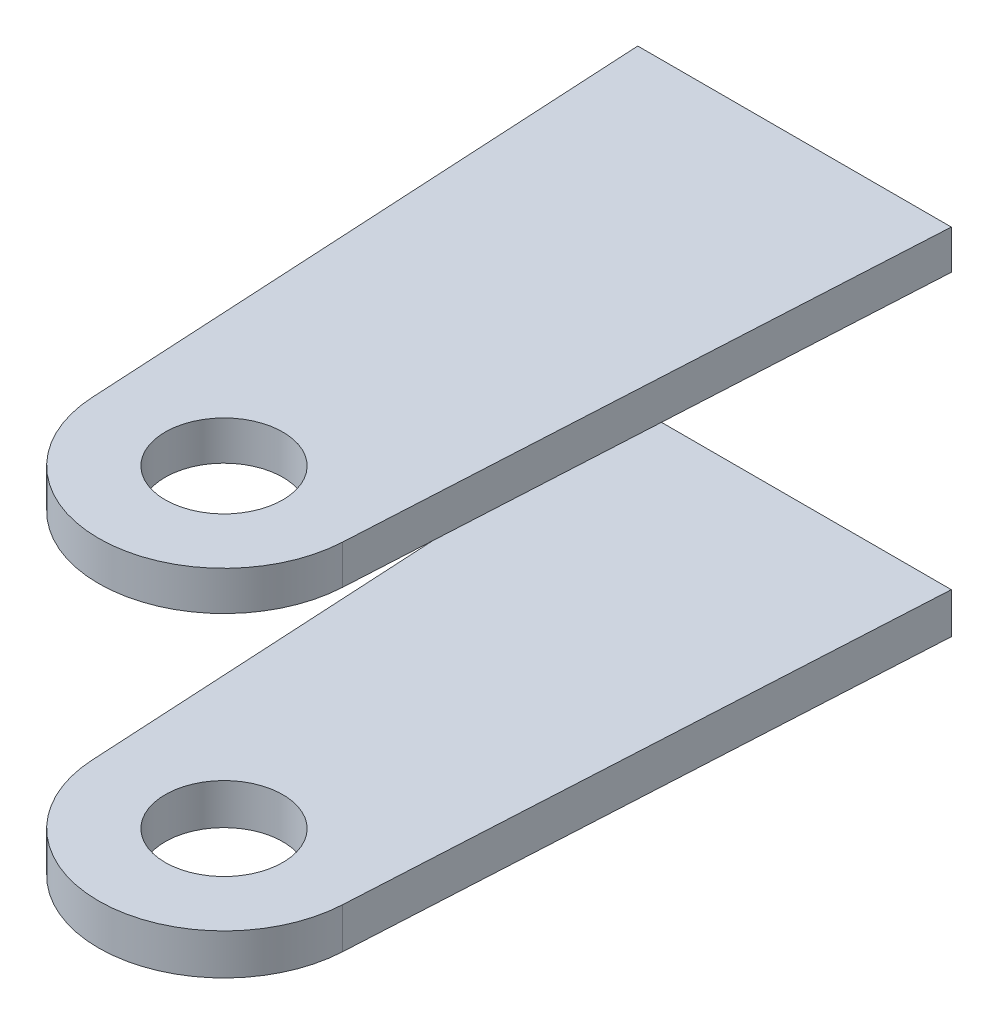
from build123d import *

# Parameters (mm, degrees)
BOSS_EXTRUDE3_START = 11.13155
SKETCH4_R           = 4.7625
BOSS_EXTRUDE3_DEPTH = 3.175
BOSS_EXTRUDE4_START = -11.13155
SKETCH4_3_R         = 4.7625
BOSS_EXTRUDE4_DEPTH = 3.302


with BuildPart() as part:
    # Sketch4 → Boss-Extrude3 (new body)
    with BuildSketch(Plane(origin=(0, 0, 0), x_dir=(1, 0, 0), z_dir=(0, 1, 0)).offset(BOSS_EXTRUDE3_START)):
        with BuildLine():
            ThreePointArc((-10.144870493, -0.554258673), (0, -10.16), (10.144870493, -0.554258673))
            Line((10.144870493, -0.554258673), (12.7, 46.213539816))
            Line((12.7, 46.213539816), (-12.7, 46.213539816))
            Line((-12.7, 46.213539816), (-10.144870493, -0.554258673))
        make_face()
        Circle(SKETCH4_R, mode=Mode.SUBTRACT)
    extrude(amount=BOSS_EXTRUDE3_DEPTH)


with BuildPart() as body_2:
    # Sketch4<3> → Boss-Extrude4 (new body)
    with BuildSketch(Plane(origin=(0, 0, 0), x_dir=(1, 0, 0), z_dir=(0, 1, 0)).offset(BOSS_EXTRUDE4_START)):
        with BuildLine():
            ThreePointArc((-10.144870493, -0.554258673), (0, -10.16), (10.144870493, -0.554258673))
            Line((10.144870493, -0.554258673), (12.7, 46.213539816))
            Line((12.7, 46.213539816), (-12.7, 46.213539816))
            Line((-12.7, 46.213539816), (-10.144870493, -0.554258673))
        make_face()
        Circle(SKETCH4_3_R, mode=Mode.SUBTRACT)
    extrude(amount=-BOSS_EXTRUDE4_DEPTH)


solid = Compound([part.part, body_2.part])
